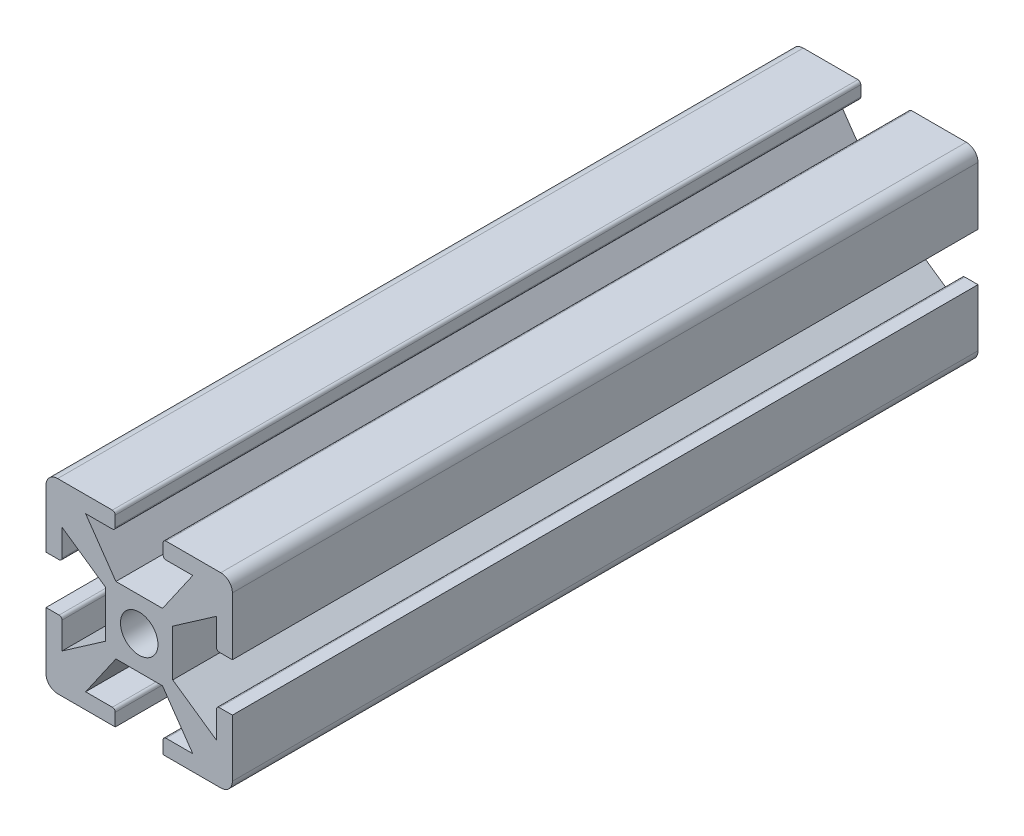
from build123d import *

# Parameters (mm, degrees)
SKETCH1_W                   = 25.4
SKETCH1_H                   = 25.4
BOSS_EXTRUDE1_DEPTH         = 101.6
FILLET1_R                   = 1.5875
HOLE1_OUTLINE_R             = 2.5527
HOLE1_DEPTH                 = 101.6
SKETCH7_W                   = 6.5278
SKETCH7_H                   = 2.2352
CUT_EXTRUDE2_DEPTH          = 101.6
FILLET4_R                   = 0.396875
CIRPATTERN2_DEPTH           = 101.6
F_1_4_20_TAPPED_HOLE1_D     = 5.1054
F_1_4_20_TAPPED_HOLE1_DEPTH = 6.35
F_1_4_20_TAPPED_HOLE1_TIP   = 1.533816902


# Read off the part's stored shape, not the designer's step: Hole1, CirPattern2
with BuildPart() as part:
    # Sketch1 → Boss-Extrude1 (new body)
    with BuildSketch(Plane.XY):
        Rectangle(SKETCH1_W, SKETCH1_H)
    extrude(amount=BOSS_EXTRUDE1_DEPTH)

    # Fillet1
    fillet1_edges = [part.edges().sort_by_distance(p)[0] for p in [
        (12.7, -12.7, 50.8),
        (-12.7, -12.7, 50.8),
        (-12.7, 12.7, 50.8),
        (12.7, 12.7, 50.8),
    ]]
    fillet(fillet1_edges, radius=FILLET1_R)

    # Hole1 outline → Hole1 (cut)
    with BuildSketch(Plane.XY):
        with Locations((0, -0.048792482)):
            Circle(HOLE1_OUTLINE_R)
    extrude(amount=HOLE1_DEPTH, mode=Mode.SUBTRACT)

    # Sketch7 → Cut-Extrude2 (cut)
    with BuildSketch(Plane.XY.offset(101.6)):
        with Locations((0, 11.5824)):
            Rectangle(SKETCH7_W, SKETCH7_H)
        Polygon((-3.175, 4.5212), (-7.3025, 10.4648), (7.3025, 10.4648), (3.175, 4.5212), align=None)
    extrude(amount=-CUT_EXTRUDE2_DEPTH, mode=Mode.SUBTRACT)

    # Fillet4
    fillet4_edges = [part.edges().sort_by_distance(p)[0] for p in [
        (-3.2639, 10.4648, 50.8),
        (-3.2639, 12.7, 50.8),
        (3.2639, 12.7, 50.8),
        (3.2639, 10.4648, 50.8),
    ]]
    fillet(fillet4_edges, radius=FILLET4_R)

    # CirPattern2 outline → CirPattern2 (cut)
    with BuildSketch(Plane.XY):
        with BuildLine():
            ThreePointArc((-3.660775, -10.562384964), (-3.380141996, -10.67862696), (-3.2639, -10.959259964))
            Line((-3.2639, -10.959259964), (-3.2639, -12.7))
            Line((-3.2639, -12.7), (3.2639, -12.7))
            Line((3.2639, -12.7), (3.2639, -10.959259964))
            ThreePointArc((3.2639, -10.959259964), (3.380141996, -10.67862696), (3.660775, -10.562384964))
            Line((3.660775, -10.562384964), (7.3025, -10.562384964))
            Line((7.3025, -10.562384964), (3.175, -4.618784964))
            Line((3.175, -4.618784964), (-3.175, -4.618784964))
            Line((-3.175, -4.618784964), (-7.3025, -10.562384964))
            Line((-7.3025, -10.562384964), (-3.660775, -10.562384964))
        make_face()
        with BuildLine():
            Line((-12.7, -3.312692482), (-10.910467482, -3.312692482))
            ThreePointArc((-10.910467482, -3.312692482), (-10.629834478, -3.428934478), (-10.513592482, -3.709567482))
            Line((-10.513592482, -3.709567482), (-10.513592482, -7.351292482))
            Line((-10.513592482, -7.351292482), (-4.569992482, -3.223792482))
            Line((-4.569992482, -3.223792482), (-4.569992482, 3.126207518))
            Line((-4.569992482, 3.126207518), (-10.513592482, 7.253707518))
            Line((-10.513592482, 7.253707518), (-10.513592482, 3.611982518))
            ThreePointArc((-10.513592482, 3.611982518), (-10.629834478, 3.331349514), (-10.910467482, 3.215107518))
            Line((-10.910467482, 3.215107518), (-12.7, 3.215107518))
            Line((-12.7, 3.215107518), (-12.7, -3.312692482))
        make_face()
        with BuildLine():
            ThreePointArc((10.513592482, -3.709567482), (10.629834478, -3.428934478), (10.910467482, -3.312692482))
            Line((10.910467482, -3.312692482), (12.7, -3.312692482))
            Line((12.7, -3.312692482), (12.7, 3.215107518))
            Line((12.7, 3.215107518), (10.910467482, 3.215107518))
            ThreePointArc((10.910467482, 3.215107518), (10.629834478, 3.331349514), (10.513592482, 3.611982518))
            Line((10.513592482, 3.611982518), (10.513592482, 7.253707518))
            Line((10.513592482, 7.253707518), (4.569992482, 3.126207518))
            Line((4.569992482, 3.126207518), (4.569992482, -3.223792482))
            Line((4.569992482, -3.223792482), (10.513592482, -7.351292482))
            Line((10.513592482, -7.351292482), (10.513592482, -3.709567482))
        make_face()
    extrude(amount=CIRPATTERN2_DEPTH, mode=Mode.SUBTRACT)

    # 1/4-20 Tapped Hole1
    with Locations(Plane(origin=(0, -0.048792482, 101.6), x_dir=(1, 0, 0), z_dir=(0, 0, 1))):
        with Locations((0, 0)):
            Hole(F_1_4_20_TAPPED_HOLE1_D / 2, depth=F_1_4_20_TAPPED_HOLE1_DEPTH)
            with Locations((0, 0, -(F_1_4_20_TAPPED_HOLE1_DEPTH + F_1_4_20_TAPPED_HOLE1_TIP / 2))):  # 118° drill point
                Cone(0, F_1_4_20_TAPPED_HOLE1_D / 2, F_1_4_20_TAPPED_HOLE1_TIP, mode=Mode.SUBTRACT)


solid = part.part
